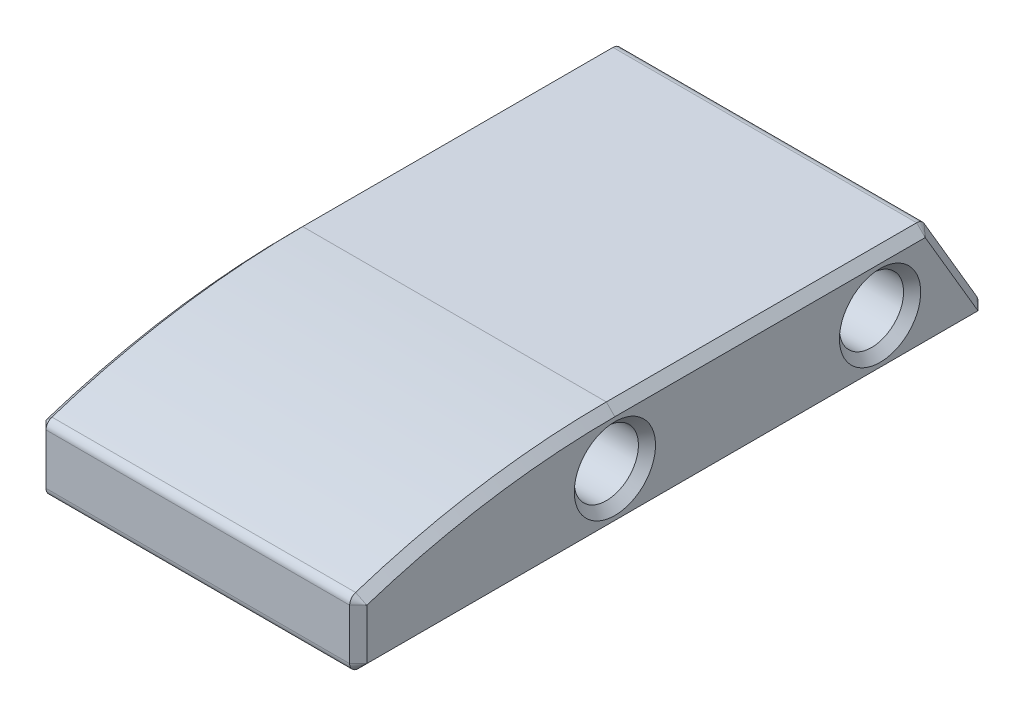
from build123d import *

# Parameters (mm, degrees)
STOCK_HAMMERSAW_START                 = -88.9
STOCK_HAMMERSAW_MULTIBODY_1_OUTLINE_R = 4.7625
STOCK_HAMMERSAW_MULTIBODY_1_DEPTH     = 47.625
FILLET1_R                             = 1.27
CHAMFER1_SIZE                         = 1.27


# Read off the part's stored shape, not the designer's step: Stock-HammerSaw Multibody-1
with BuildPart() as part:
    # Stock-HammerSaw Multibody-1 outline → Stock-HammerSaw Multibody-1 (new body)
    with BuildSketch(Plane.YZ.offset(STOCK_HAMMERSAW_START)):
        with BuildLine():
            Line((66.675, -151.571456433), (66.675, -104.775))
            ThreePointArc((66.675, -104.775), (65.121562553, -85.476521096), (60.501252996, -66.675))
            Line((60.501252996, -66.675), (50.8, -66.675))
            Line((50.8, -66.675), (50.8, -160.903282658))
            Line((50.8, -160.903282658), (66.675, -151.571456433))
        make_face()
        with Locations((58.7375, -144.145)):
            Circle(STOCK_HAMMERSAW_MULTIBODY_1_OUTLINE_R, mode=Mode.SUBTRACT)
        with Locations((58.7375, -104.775)):
            Circle(STOCK_HAMMERSAW_MULTIBODY_1_OUTLINE_R, mode=Mode.SUBTRACT)
    extrude(amount=STOCK_HAMMERSAW_MULTIBODY_1_DEPTH)

    # Fillet1
    fillet1_edges = [part.edges().sort_by_distance(p)[0] for p in [
        (-65.0875, 66.675, -151.571456433),
        (-65.0875, 50.8, -160.903282658),
        (-65.0875, 50.8, -66.675),
        (-65.0875, 60.501252996, -66.675),
    ]]
    fillet(fillet1_edges, radius=FILLET1_R)

    # Chamfer1
    chamfer1_edges = [part.edges().sort_by_distance(p)[0] for p in [
        (-41.275, 53.975, -144.145),
        (-41.275, 53.975, -104.775),
        (-88.9, 65.194617982, -85.932902187),
        (-88.9, 53.975, -144.145),
        (-88.9, 53.975, -104.775),
        (-88.9, 50.8, -113.314283072),
        (-41.275, 50.8, -113.314283072),
        (-41.275, 55.825875065, -66.675),
        (-41.275, 59.381087146, -155.859048701),
        (-41.275, 66.675, -127.809916057),
        (-41.275, 51.171974388, -67.046974388),
        (-41.275, 60.328510865, -66.917747157),
        (-41.275, 66.507328371, -151.475523927),
        (-41.275, 51.439308188, -159.785894515),
        (-88.9, 59.381087146, -155.859048701),
        (-88.9, 66.675, -127.809916057),
        (-88.9, 55.825875065, -66.675),
        (-88.9, 51.171974388, -67.046974388),
        (-88.9, 60.328510865, -66.917747157),
        (-88.9, 66.507328371, -151.475523927),
        (-88.9, 51.439308188, -159.785894515),
        (-41.275, 65.194617982, -85.932902187),
    ]]
    chamfer(chamfer1_edges, length=CHAMFER1_SIZE)


solid = part.part
